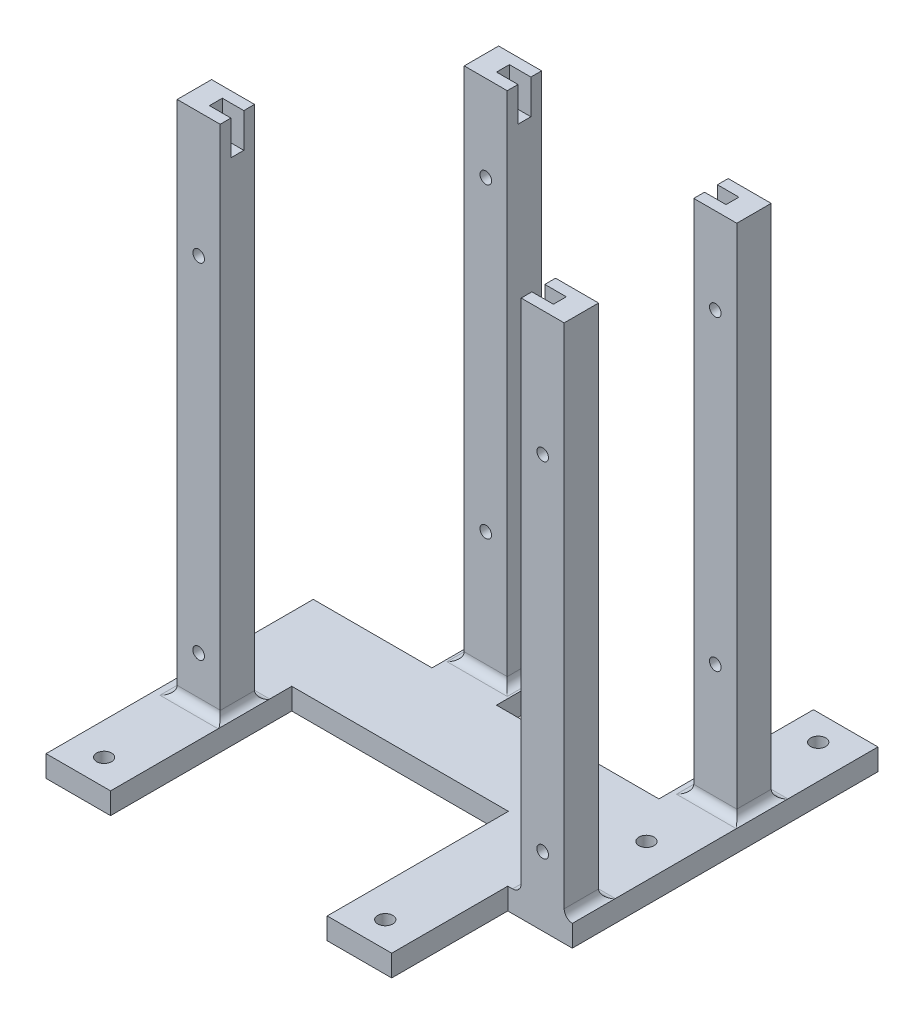
from build123d import *

# Parameters (mm, degrees)
SKETCH1_R           = 1.7499999999999998
SKETCH1_R_2         = 1.749999999999997
BOSS_EXTRUDE1_DEPTH = 5
SKETCH2_W           = 9.999999999999986
SKETCH2_H           = 7.9999999999999964
SKETCH2_H_2         = 8.000000000000028
BOSS_EXTRUDE2_DEPTH = 120
SKETCH3_R           = 2.500000000000001
SKETCH3_R_2         = 2.4999999999999996
SKETCH3_R_3         = 2.4999999999999956
BOSS_EXTRUDE3_DEPTH = 2
CUT_EXTRUDE1_REACH  = 170.68
SKETCH4_R           = 1.3500000000000016
SKETCH4_R_2         = 1.3500000000000005
SKETCH4_R_3         = 1.3500000000000054
SKETCH4_R_4         = 1.3500000000000065
SKETCH8_R           = 2.5000000000000027
SKETCH8_R_2         = 2.4999999999999956
BOSS_EXTRUDE5_DEPTH = 2
CUT_EXTRUDE3_REACH  = 177.137
SKETCH9_R           = 1.3499999999999999
SKETCH9_R_2         = 1.3499999999999979
SKETCH9_R_3         = 1.3500000000000065
FILLET1_R           = 2
SKETCH10_W          = 4.999999999999993
SKETCH10_H          = 2.9999999999999964
SKETCH10_W_2        = 5
SKETCH10_H_2        = 3.000000000000014
SKETCH10_W_3        = 4.999999999999986
CUT_EXTRUDE4_DEPTH  = 8


with BuildPart() as part:
    # Sketch1 → Boss-Extrude1 (new body)
    with BuildSketch(Plane(origin=(0, 0, 0), x_dir=(1, 0, 0), z_dir=(0, 1, 0))):
        Polygon((95.38000000000002, 26.999999999999996), (80.38000000000001, 27.000000000000004), (80.38000000000001, 3.47e-15), (65.38, 3.47e-15), (65.38, 42.13999999999999), (15, 42.13999999999999), (15, 8.1e-16), (0, 0), (0, 62.14), (27.60999999999998, 62.14), (27.609999999999985, 82.14), (42.60999999999998, 82.14), (42.609999999999985, 62.14), (80.38000000000001, 62.14), (80.38000000000002, 98.08), (95.38000000000001, 98.08), align=None)
        with Locations(Location((7.5, 6, 0), (0, 0, 270))):
            Circle(SKETCH1_R, mode=Mode.SUBTRACT)
        with Locations(Location((72.88, 5.999999999999998, 0), (0, 0, 270))):
            Circle(SKETCH1_R_2, mode=Mode.SUBTRACT)
        with Locations(Location((87.48999999999998, 52.14, 0), (0, 0, 270))):
            Circle(SKETCH1_R_2, mode=Mode.SUBTRACT)
        with Locations(Location((87.48999999999998, 92.08, 0), (0, 0, 270))):
            Circle(SKETCH1_R_2, mode=Mode.SUBTRACT)
    extrude(amount=BOSS_EXTRUDE1_DEPTH)

    # Sketch2 → Boss-Extrude2 (add)
    with BuildSketch(Plane(origin=(0, 5, 0), x_dir=(1, 0, 0), z_dir=(0, 1, 0))):
        with Locations((88.48999999999998, 31)):
            Rectangle(SKETCH2_W, SKETCH2_H)
        Polygon((13.489999999999974, 35), (3.489999999999993, 35), (3.4899999999999944, 26.99999999999999), (13.489999999999979, 26.999999999999993), align=None)
        Polygon((30.10999999999999, 75.14000000000001), (40.10999999999998, 75.14000000000001), (40.10999999999997, 67.14), (30.109999999999992, 67.14), align=None)
        with Locations((88.48999999999998, 71.14)):
            Rectangle(SKETCH2_W, SKETCH2_H_2)
    extrude(amount=BOSS_EXTRUDE2_DEPTH)

    # Sketch3 → Boss-Extrude3 (add)
    with BuildSketch(Plane(origin=(0, 0, -35), x_dir=(-1, 0, 0), z_dir=(0, 0, -1))):
        with Locations(Location((-8.489999999999984, 96, 0), (0, 0, 180))):
            Circle(SKETCH3_R)
        with Locations(Location((-8.489999999999984, 16, 0), (0, 0, 180))):
            Circle(SKETCH3_R_2)
        with Locations(Location((-88.48999999999998, 16, 0), (0, 0, 180))):
            Circle(SKETCH3_R_3)
        with Locations(Location((-88.48999999999998, 96, 0), (0, 0, 180))):
            Circle(SKETCH3_R_3)
    extrude(amount=BOSS_EXTRUDE3_DEPTH)

    # Sketch4 → Cut-Extrude1 (cut, up to next)
    with BuildSketch(Plane(origin=(0, 0, -37.00000000000001), x_dir=(-1, 0, 0), z_dir=(0, 0, -1)), mode=Mode.PRIVATE) as cut_extrude1_sk1:
        with Locations((-8.489999999999984, 96)):
            Circle(SKETCH4_R)
    cut_extrude1_tool1 = extrude(cut_extrude1_sk1.sketch, amount=-CUT_EXTRUDE1_REACH, mode=Mode.PRIVATE) & part.part
    # Sketch4 → Cut-Extrude1 (cut, up to next)
    with BuildSketch(Plane(origin=(0, 0, -37.00000000000001), x_dir=(-1, 0, 0), z_dir=(0, 0, -1)), mode=Mode.PRIVATE) as cut_extrude1_sk2:
        with Locations((-8.489999999999984, 16)):
            Circle(SKETCH4_R_2)
    cut_extrude1_tool2 = extrude(cut_extrude1_sk2.sketch, amount=-CUT_EXTRUDE1_REACH, mode=Mode.PRIVATE) & part.part
    # Sketch4 → Cut-Extrude1 (cut, up to next)
    with BuildSketch(Plane(origin=(0, 0, -37.00000000000001), x_dir=(-1, 0, 0), z_dir=(0, 0, -1)), mode=Mode.PRIVATE) as cut_extrude1_sk3:
        with Locations((-88.48999999999998, 16)):
            Circle(SKETCH4_R_3)
    cut_extrude1_tool3 = extrude(cut_extrude1_sk3.sketch, amount=-CUT_EXTRUDE1_REACH, mode=Mode.PRIVATE) & part.part
    # Sketch4 → Cut-Extrude1 (cut, up to next)
    with BuildSketch(Plane(origin=(0, 0, -37.00000000000001), x_dir=(-1, 0, 0), z_dir=(0, 0, -1)), mode=Mode.PRIVATE) as cut_extrude1_sk4:
        with Locations((-88.48999999999998, 96)):
            Circle(SKETCH4_R_4)
    cut_extrude1_tool4 = extrude(cut_extrude1_sk4.sketch, amount=-CUT_EXTRUDE1_REACH, mode=Mode.PRIVATE) & part.part
    add(cut_extrude1_tool1.solids().sort_by_distance((8.49, 96, -37))[0], mode=Mode.SUBTRACT)
    add(cut_extrude1_tool2.solids().sort_by_distance((8.49, 16, -37))[0], mode=Mode.SUBTRACT)
    add(cut_extrude1_tool3.solids().sort_by_distance((88.49, 16, -37))[0], mode=Mode.SUBTRACT)
    add(cut_extrude1_tool4.solids().sort_by_distance((88.49, 96, -37))[0], mode=Mode.SUBTRACT)

    # Sketch8 → Boss-Extrude5 (add)
    with BuildSketch(Plane(origin=(0, 0, -75.14000000000001), x_dir=(-1, 0, 0), z_dir=(0, 0, -1))):
        with Locations(Location((-35.10999999999998, 105, 0), (0, 0, 180))):
            Circle(SKETCH8_R)
        with Locations(Location((-35.10999999999997, 33.669999999999995, 0), (0, 0, 180))):
            Circle(SKETCH8_R)
        with Locations(Location((-88.48999999999998, 105, 0), (0, 0, 180))):
            Circle(SKETCH8_R_2)
        with Locations(Location((-88.48999999999998, 33.669999999999995, 0), (0, 0, 180))):
            Circle(SKETCH8_R_2)
    extrude(amount=BOSS_EXTRUDE5_DEPTH)

    # Sketch9 → Cut-Extrude3 (cut, up to next)
    with BuildSketch(Plane(origin=(0, 0, -77.14000000000001), x_dir=(-1, 0, 0), z_dir=(0, 0, -1)), mode=Mode.PRIVATE) as cut_extrude3_sk1:
        with Locations((-35.10999999999998, 105)):
            Circle(SKETCH9_R)
    cut_extrude3_tool1 = extrude(cut_extrude3_sk1.sketch, amount=-CUT_EXTRUDE3_REACH, mode=Mode.PRIVATE) & part.part
    # Sketch9 → Cut-Extrude3 (cut, up to next)
    with BuildSketch(Plane(origin=(0, 0, -77.14000000000001), x_dir=(-1, 0, 0), z_dir=(0, 0, -1)), mode=Mode.PRIVATE) as cut_extrude3_sk2:
        with Locations((-35.10999999999997, 33.669999999999995)):
            Circle(SKETCH9_R_2)
    cut_extrude3_tool2 = extrude(cut_extrude3_sk2.sketch, amount=-CUT_EXTRUDE3_REACH, mode=Mode.PRIVATE) & part.part
    # Sketch9 → Cut-Extrude3 (cut, up to next)
    with BuildSketch(Plane(origin=(0, 0, -77.14000000000001), x_dir=(-1, 0, 0), z_dir=(0, 0, -1)), mode=Mode.PRIVATE) as cut_extrude3_sk3:
        with Locations((-88.48999999999998, 33.669999999999995)):
            Circle(SKETCH9_R_3)
    cut_extrude3_tool3 = extrude(cut_extrude3_sk3.sketch, amount=-CUT_EXTRUDE3_REACH, mode=Mode.PRIVATE) & part.part
    # Sketch9 → Cut-Extrude3 (cut, up to next)
    with BuildSketch(Plane(origin=(0, 0, -77.14000000000001), x_dir=(-1, 0, 0), z_dir=(0, 0, -1)), mode=Mode.PRIVATE) as cut_extrude3_sk4:
        with Locations((-88.48999999999998, 105)):
            Circle(SKETCH9_R_3)
    cut_extrude3_tool4 = extrude(cut_extrude3_sk4.sketch, amount=-CUT_EXTRUDE3_REACH, mode=Mode.PRIVATE) & part.part
    add(cut_extrude3_tool1.solids().sort_by_distance((35.11, 105, -77.14))[0], mode=Mode.SUBTRACT)
    add(cut_extrude3_tool2.solids().sort_by_distance((35.11, 33.67, -77.14))[0], mode=Mode.SUBTRACT)
    add(cut_extrude3_tool3.solids().sort_by_distance((88.49, 33.67, -77.14))[0], mode=Mode.SUBTRACT)
    add(cut_extrude3_tool4.solids().sort_by_distance((88.49, 105, -77.14))[0], mode=Mode.SUBTRACT)

    # Fillet1
    # the kernel refuses this fillet: 2 mm, written as the material it adds along each edge
    with BuildSketch(Plane(origin=(93.48999999999998, 5, -27.000000000000004), x_dir=(1, 0, 0), z_dir=(0, 0, -1))) as fillet1_piece_1:
        with BuildLine():
            CenterArc((2, -1.9969727088771165), FILLET1_R, 93.1528588040452, 86.8471411959548)
            Line((0, -1.9969727088771165), (-0.04000000000000625, -1.9969727088771165))
            Line((-0.04000000000000625, -1.9969727088771165), (-0.04000000000000625, 0))
            Line((-0.04000000000000625, 0), (0, 0.04000000000000004))
            ThreePointArc((0, 0.04000000000000004), (0.9450000000000216, 0.04000000000000004), (1.8878000000000412, 0.03993945417754219))
            Line((1.8878000000000412, 0.03993945417754219), (1.8900000000000432, 0))
        make_face()
    extrude(amount=7.9999999999999964)
    with BuildSketch(Plane(origin=(93.48999999999998, 5, -75.14000000000001), x_dir=(1, 0, 0), z_dir=(0, 0, 1))) as fillet1_piece_2:
        with BuildLine():
            CenterArc((2, 1.9969727088771156), FILLET1_R, 180, 86.8471411959544)
            Line((0, 1.9969727088771156), (-0.04000000000000625, 1.9969727088771156))
            Line((-0.04000000000000625, 1.9969727088771156), (-0.04000000000000625, 0))
            Line((-0.04000000000000625, 0), (0, -0.04000000000000004))
            ThreePointArc((0, -0.04000000000000004), (0.9450000000000216, -0.04000000000000004), (1.887800000000027, -0.03993945417754219))
            Line((1.887800000000027, -0.03993945417754219), (1.890000000000029, 0))
        make_face()
    extrude(amount=8.000000000000028)
    with BuildSketch(Plane(origin=(93.48999999999998, 5, -67.13999999999999), x_dir=(0, 0, 1), z_dir=(-1, 0, 0)), Plane(origin=(83.49, 5, -75.14000000000001), x_dir=(0, 0, -1), z_dir=(1, 0, 0))) as fillet1_piece_3:
        with BuildLine():
            CenterArc((FILLET1_R, FILLET1_R), FILLET1_R, 180, 90)
            Line((0, FILLET1_R), (-FILLET1_R * 0.02, FILLET1_R))
            Line((-FILLET1_R * 0.02, FILLET1_R), (-FILLET1_R * 0.02, -FILLET1_R * 0.02))
            Line((-FILLET1_R * 0.02, -FILLET1_R * 0.02), (FILLET1_R, -FILLET1_R * 0.02))
            Line((FILLET1_R, -FILLET1_R * 0.02), (FILLET1_R, 0))
        make_face()
    extrude(amount=9.999999999999986)
    with BuildSketch(Plane(origin=(93.48999999999998, 5, -35), x_dir=(0, 0, -1), z_dir=(-1, 0, 0))) as fillet1_piece_4:
        with BuildLine():
            CenterArc((FILLET1_R, -FILLET1_R), FILLET1_R, 90, 90)
            Line((0, -FILLET1_R), (-FILLET1_R * 0.02, -FILLET1_R))
            Line((-FILLET1_R * 0.02, -FILLET1_R), (-FILLET1_R * 0.02, FILLET1_R * 0.02))
            Line((-FILLET1_R * 0.02, FILLET1_R * 0.02), (FILLET1_R, FILLET1_R * 0.02))
            Line((FILLET1_R, FILLET1_R * 0.02), (FILLET1_R, 0))
        make_face()
    extrude(amount=9.999999999999986)
    with BuildSketch(Plane(origin=(83.49, 5, -35), x_dir=(-1, 0, 0), z_dir=(0, 0, 1))) as fillet1_piece_5:
        with BuildLine():
            CenterArc((FILLET1_R, -FILLET1_R), FILLET1_R, 90, 90)
            Line((0, -FILLET1_R), (-FILLET1_R * 0.02, -FILLET1_R))
            Line((-FILLET1_R * 0.02, -FILLET1_R), (-FILLET1_R * 0.02, FILLET1_R * 0.02))
            Line((-FILLET1_R * 0.02, FILLET1_R * 0.02), (FILLET1_R, FILLET1_R * 0.02))
            Line((FILLET1_R, FILLET1_R * 0.02), (FILLET1_R, 0))
        make_face()
    extrude(amount=7.9999999999999964)
    with BuildSketch(Plane(origin=(83.49, 5, -67.13999999999999), x_dir=(-1, 0, 0), z_dir=(0, 0, -1))) as fillet1_piece_6:
        with BuildLine():
            CenterArc((FILLET1_R, FILLET1_R), FILLET1_R, 180, 90)
            Line((0, FILLET1_R), (-FILLET1_R * 0.02, FILLET1_R))
            Line((-FILLET1_R * 0.02, FILLET1_R), (-FILLET1_R * 0.02, -FILLET1_R * 0.02))
            Line((-FILLET1_R * 0.02, -FILLET1_R * 0.02), (FILLET1_R, -FILLET1_R * 0.02))
            Line((FILLET1_R, -FILLET1_R * 0.02), (FILLET1_R, 0))
        make_face()
    extrude(amount=8.000000000000028)
    with BuildSketch(Plane(origin=(30.10999999999999, 5, -75.14000000000001), x_dir=(0, 0, -1), z_dir=(1, 0, 0))) as fillet1_piece_7:
        with BuildLine():
            CenterArc((FILLET1_R, FILLET1_R), FILLET1_R, 180, 90)
            Line((0, FILLET1_R), (-FILLET1_R * 0.02, FILLET1_R))
            Line((-FILLET1_R * 0.02, FILLET1_R), (-FILLET1_R * 0.02, -FILLET1_R * 0.02))
            Line((-FILLET1_R * 0.02, -FILLET1_R * 0.02), (FILLET1_R, -FILLET1_R * 0.02))
            Line((FILLET1_R, -FILLET1_R * 0.02), (FILLET1_R, 0))
        make_face()
    extrude(amount=9.99999999999999)
    with BuildSketch(Plane(origin=(30.109999999999992, 5, -67.14), x_dir=(-1, 0, 4.4e-16), z_dir=(-4.4e-16, 0, -1))) as fillet1_piece_8:
        with BuildLine():
            CenterArc((FILLET1_R, FILLET1_R), FILLET1_R, 180, 90)
            Line((0, FILLET1_R), (-FILLET1_R * 0.02, FILLET1_R))
            Line((-FILLET1_R * 0.02, FILLET1_R), (-FILLET1_R * 0.02, -FILLET1_R * 0.02))
            Line((-FILLET1_R * 0.02, -FILLET1_R * 0.02), (FILLET1_R, -FILLET1_R * 0.02))
            Line((FILLET1_R, -FILLET1_R * 0.02), (FILLET1_R, 0))
        make_face()
    extrude(amount=8.000000000000014)
    with BuildSketch(Plane(origin=(40.10999999999998, 5, -75.14000000000001), x_dir=(1, 0, 8.9e-16), z_dir=(-8.9e-16, 0, 1))) as fillet1_piece_9:
        with BuildLine():
            CenterArc((FILLET1_R, FILLET1_R), FILLET1_R, 180, 90)
            Line((0, FILLET1_R), (-FILLET1_R * 0.02, FILLET1_R))
            Line((-FILLET1_R * 0.02, FILLET1_R), (-FILLET1_R * 0.02, -FILLET1_R * 0.02))
            Line((-FILLET1_R * 0.02, -FILLET1_R * 0.02), (FILLET1_R, -FILLET1_R * 0.02))
            Line((FILLET1_R, -FILLET1_R * 0.02), (FILLET1_R, 0))
        make_face()
    extrude(amount=8.000000000000014)
    with BuildSketch(Plane(origin=(40.10999999999997, 5, -67.14), x_dir=(0, 0, 1), z_dir=(-1, 0, 0))) as fillet1_piece_10:
        with BuildLine():
            CenterArc((FILLET1_R, FILLET1_R), FILLET1_R, 180, 90)
            Line((0, FILLET1_R), (-FILLET1_R * 0.02, FILLET1_R))
            Line((-FILLET1_R * 0.02, FILLET1_R), (-FILLET1_R * 0.02, -FILLET1_R * 0.02))
            Line((-FILLET1_R * 0.02, -FILLET1_R * 0.02), (FILLET1_R, -FILLET1_R * 0.02))
            Line((FILLET1_R, -FILLET1_R * 0.02), (FILLET1_R, 0))
        make_face()
    extrude(amount=9.999999999999979)
    with BuildSketch(Plane(origin=(13.489999999999979, 5, -26.999999999999993), x_dir=(1, 0, -6.7e-16), z_dir=(-6.7e-16, 0, -1))) as fillet1_piece_11:
        with BuildLine():
            CenterArc((2, -1.939046157263932), FILLET1_R, 104.18183372856282, 75.81816627143718)
            Line((0, -1.939046157263932), (-0.03999999999999915, -1.939046157263932))
            Line((-0.03999999999999915, -1.939046157263932), (-0.03999999999999915, 0))
            Line((-0.03999999999999915, 0), (0, 0.04000000000000004))
            ThreePointArc((0, 0.04000000000000004), (0.7550000000000114, 0.04000000000000004), (1.5002000000000209, 0.03878092314527848))
            Line((1.5002000000000209, 0.03878092314527848), (1.510000000000021, 0))
        make_face()
    extrude(amount=8.000000000000007)
    with BuildSketch(Plane(origin=(3.4899999999999944, 5, -26.99999999999999), x_dir=(3.6e-16, 0, 1), z_dir=(1, 0, -3.6e-16))) as fillet1_piece_12:
        with BuildLine():
            CenterArc((FILLET1_R, -FILLET1_R), FILLET1_R, 90, 90)
            Line((0, -FILLET1_R), (-FILLET1_R * 0.02, -FILLET1_R))
            Line((-FILLET1_R * 0.02, -FILLET1_R), (-FILLET1_R * 0.02, FILLET1_R * 0.02))
            Line((-FILLET1_R * 0.02, FILLET1_R * 0.02), (FILLET1_R, FILLET1_R * 0.02))
            Line((FILLET1_R, FILLET1_R * 0.02), (FILLET1_R, 0))
        make_face()
    extrude(amount=9.999999999999984)
    with BuildSketch(Plane(origin=(13.489999999999974, 5, -35), x_dir=(0, 0, -1), z_dir=(-1, 0, 0))) as fillet1_piece_13:
        with BuildLine():
            CenterArc((FILLET1_R, -FILLET1_R), FILLET1_R, 90, 90)
            Line((0, -FILLET1_R), (-FILLET1_R * 0.02, -FILLET1_R))
            Line((-FILLET1_R * 0.02, -FILLET1_R), (-FILLET1_R * 0.02, FILLET1_R * 0.02))
            Line((-FILLET1_R * 0.02, FILLET1_R * 0.02), (FILLET1_R, FILLET1_R * 0.02))
            Line((FILLET1_R, FILLET1_R * 0.02), (FILLET1_R, 0))
        make_face()
    extrude(amount=9.99999999999998)
    with BuildSketch(Plane(origin=(3.489999999999993, 5, -35), x_dir=(-1, 0, 1.7e-16), z_dir=(1.7e-16, 0, 1))) as fillet1_piece_14:
        with BuildLine():
            CenterArc((FILLET1_R, -FILLET1_R), FILLET1_R, 90, 90)
            Line((-1.78e-15, -FILLET1_R), (-FILLET1_R * 0.02, -FILLET1_R))
            Line((-FILLET1_R * 0.02, -FILLET1_R), (-FILLET1_R * 0.02, FILLET1_R * 0.02))
            Line((-FILLET1_R * 0.02, FILLET1_R * 0.02), (FILLET1_R, FILLET1_R * 0.02))
            Line((FILLET1_R, FILLET1_R * 0.02), (FILLET1_R, 0))
        make_face()
    extrude(amount=8.00000000000001)
    with BuildSketch(Plane(origin=(98.48999999999998, 5, -35), x_dir=(0, 0, -1), z_dir=(-1, 0, 0))) as fillet1_piece_15a_section:
        with BuildLine():
            CenterArc((FILLET1_R, -FILLET1_R), FILLET1_R, 90, 90)
            Line((0, -FILLET1_R), (-FILLET1_R * 0.02, -FILLET1_R))
            Line((-FILLET1_R * 0.02, -FILLET1_R), (-FILLET1_R * 0.02, FILLET1_R * 0.02))
            Line((-FILLET1_R * 0.02, FILLET1_R * 0.02), (FILLET1_R, FILLET1_R * 0.02))
            Line((FILLET1_R, FILLET1_R * 0.02), (FILLET1_R, 0))
        make_face()
    fillet1_piece_15a = extrude(amount=14.999999999999986, mode=Mode.PRIVATE)
    fillet1_piece_15a = split(fillet1_piece_15a, bisect_by=Plane(origin=(95.38000000000002, 5.45279022853365, -35.45279022853365), z_dir=(-1, 0, 2e-16)), keep=Keep.TOP, mode=Mode.PRIVATE)
    fillet1_piece_15a = split(fillet1_piece_15a, bisect_by=Plane(origin=(93.48999999999998, 5.45279022853365, -35.45279022853366), z_dir=(1, 0, 0)), keep=Keep.TOP, mode=Mode.PRIVATE)
    with BuildSketch(Plane(origin=(93.48999999999998, 5, -27.000000000000004), x_dir=(1, 0, 0), z_dir=(0, 0, -1))) as fillet1_piece_15b_section:
        with BuildLine():
            CenterArc((2, -1.9969727088771165), FILLET1_R, 93.1528588040452, 86.8471411959548)
            Line((0, -1.9969727088771165), (-0.04000000000000625, -1.9969727088771165))
            Line((-0.04000000000000625, -1.9969727088771165), (-0.04000000000000625, 0))
            Line((-0.04000000000000625, 0), (0, 0.04000000000000004))
            ThreePointArc((0, 0.04000000000000004), (0.9450000000000216, 0.04000000000000004), (1.8878000000000412, 0.03993945417754219))
            Line((1.8878000000000412, 0.03993945417754219), (1.8900000000000432, 0))
        make_face()
    fillet1_piece_15b = extrude(amount=12.992431772192784, mode=Mode.PRIVATE)
    fillet1_piece_15b = split(fillet1_piece_15b, bisect_by=Plane(origin=(93.93367607415175, 5.45512800985492, -35), z_dir=(0, 0, -1)), keep=Keep.TOP, mode=Mode.PRIVATE)
    fillet1_piece_15 = fillet1_piece_15a & fillet1_piece_15b
    add(fillet1_piece_15)
    with BuildSketch(Plane(origin=(83.49, 5, -75.14000000000001), x_dir=(0, 0, -1), z_dir=(1, 0, 0))) as fillet1_piece_16a_section:
        with BuildLine():
            CenterArc((FILLET1_R, FILLET1_R), FILLET1_R, 180, 90)
            Line((0, FILLET1_R), (-FILLET1_R * 0.02, FILLET1_R))
            Line((-FILLET1_R * 0.02, FILLET1_R), (-FILLET1_R * 0.02, -FILLET1_R * 0.02))
            Line((-FILLET1_R * 0.02, -FILLET1_R * 0.02), (FILLET1_R, -FILLET1_R * 0.02))
            Line((FILLET1_R, -FILLET1_R * 0.02), (FILLET1_R, 0))
        make_face()
    fillet1_piece_16a = extrude(amount=14.999999999999986, mode=Mode.PRIVATE)
    fillet1_piece_16a = split(fillet1_piece_16a, bisect_by=Plane(origin=(95.38000000000001, 5.452790228533658, -75.59279022853367), z_dir=(-1, 0, 2e-16)), keep=Keep.TOP, mode=Mode.PRIVATE)
    fillet1_piece_16a = split(fillet1_piece_16a, bisect_by=Plane(origin=(93.48999999999998, 5.452790228533658, -75.59279022853367), z_dir=(1, 0, 0)), keep=Keep.TOP, mode=Mode.PRIVATE)
    with BuildSketch(Plane(origin=(93.48999999999998, 5, -80.1324317721928), x_dir=(1, 0, 0), z_dir=(0, 0, 1))) as fillet1_piece_16b_section:
        with BuildLine():
            CenterArc((2, 1.9969727088771156), FILLET1_R, 180, 86.8471411959544)
            Line((0, 1.9969727088771156), (-0.04000000000000625, 1.9969727088771156))
            Line((-0.04000000000000625, 1.9969727088771156), (-0.04000000000000625, 0))
            Line((-0.04000000000000625, 0), (0, -0.04000000000000004))
            ThreePointArc((0, -0.04000000000000004), (0.9450000000000216, -0.04000000000000004), (1.887800000000027, -0.03993945417754219))
            Line((1.887800000000027, -0.03993945417754219), (1.890000000000029, 0))
        make_face()
    fillet1_piece_16b = extrude(amount=12.992431772192816, mode=Mode.PRIVATE)
    fillet1_piece_16b = split(fillet1_piece_16b, bisect_by=Plane(origin=(93.93367607415274, 5.455128009853669, -75.14000000000001), z_dir=(0, 0, -1)), keep=Keep.TOP, mode=Mode.PRIVATE)
    fillet1_piece_16 = fillet1_piece_16a & fillet1_piece_16b
    add(fillet1_piece_16)
    with BuildSketch(Plane(origin=(93.48999999999998, 5, -75.14000000000001), x_dir=(1, 0, 0), z_dir=(0, 0, 1))) as fillet1_piece_17a_section:
        with BuildLine():
            CenterArc((2, 1.9969727088771156), FILLET1_R, 180, 86.8471411959544)
            Line((0, 1.9969727088771156), (-0.04000000000000625, 1.9969727088771156))
            Line((-0.04000000000000625, 1.9969727088771156), (-0.04000000000000625, 0))
            Line((-0.04000000000000625, 0), (0, -0.04000000000000004))
            ThreePointArc((0, -0.04000000000000004), (0.9450000000000216, -0.04000000000000004), (1.887800000000027, -0.03993945417754219))
            Line((1.887800000000027, -0.03993945417754219), (1.890000000000029, 0))
        make_face()
    fillet1_piece_17a = extrude(amount=12.992431772192816, mode=Mode.PRIVATE)
    fillet1_piece_17a = split(fillet1_piece_17a, bisect_by=Plane(origin=(93.93367607415267, 5.45512800985373, -67.13999999999999), z_dir=(0, 0, 1)), keep=Keep.TOP, mode=Mode.PRIVATE)
    with BuildSketch(Plane(origin=(98.48999999999998, 5, -67.13999999999999), x_dir=(0, 0, 1), z_dir=(-1, 0, 0))) as fillet1_piece_17b_section:
        with BuildLine():
            CenterArc((FILLET1_R, FILLET1_R), FILLET1_R, 180, 90)
            Line((0, FILLET1_R), (-FILLET1_R * 0.02, FILLET1_R))
            Line((-FILLET1_R * 0.02, FILLET1_R), (-FILLET1_R * 0.02, -FILLET1_R * 0.02))
            Line((-FILLET1_R * 0.02, -FILLET1_R * 0.02), (FILLET1_R, -FILLET1_R * 0.02))
            Line((FILLET1_R, -FILLET1_R * 0.02), (FILLET1_R, 0))
        make_face()
    fillet1_piece_17b = extrude(amount=14.999999999999986, mode=Mode.PRIVATE)
    fillet1_piece_17b = split(fillet1_piece_17b, bisect_by=Plane(origin=(95.38000000000001, 5.452790228533658, -66.68720977146636), z_dir=(-1, 0, 2e-16)), keep=Keep.TOP, mode=Mode.PRIVATE)
    fillet1_piece_17b = split(fillet1_piece_17b, bisect_by=Plane(origin=(93.48999999999998, 5.452790228533658, -66.68720977146636), z_dir=(1, 0, 0)), keep=Keep.TOP, mode=Mode.PRIVATE)
    fillet1_piece_17 = fillet1_piece_17a & fillet1_piece_17b
    add(fillet1_piece_17)
    with BuildSketch(Plane(origin=(93.48999999999998, 5, -67.13999999999999), x_dir=(0, 0, 1), z_dir=(-1, 0, 0))) as fillet1_piece_18a_section:
        with BuildLine():
            CenterArc((FILLET1_R, FILLET1_R), FILLET1_R, 180, 90)
            Line((0, FILLET1_R), (-FILLET1_R * 0.02, FILLET1_R))
            Line((-FILLET1_R * 0.02, FILLET1_R), (-FILLET1_R * 0.02, -FILLET1_R * 0.02))
            Line((-FILLET1_R * 0.02, -FILLET1_R * 0.02), (FILLET1_R, -FILLET1_R * 0.02))
            Line((FILLET1_R, -FILLET1_R * 0.02), (FILLET1_R, 0))
        make_face()
    fillet1_piece_18a = extrude(amount=14.999999999999986, mode=Mode.PRIVATE)
    fillet1_piece_18a = split(fillet1_piece_18a, bisect_by=Plane(origin=(80.38000000000001, 5.452790228533659, -66.68720977146634), z_dir=(1, 0, 4e-16)), keep=Keep.TOP, mode=Mode.PRIVATE)
    fillet1_piece_18a = split(fillet1_piece_18a, bisect_by=Plane(origin=(83.49, 5.452790228533659, -66.68720977146634), z_dir=(-1, 0, 0)), keep=Keep.TOP, mode=Mode.PRIVATE)
    with BuildSketch(Plane(origin=(83.49, 5, -62.139999999999986), x_dir=(-1, 0, 0), z_dir=(0, 0, -1))) as fillet1_piece_18b_section:
        with BuildLine():
            CenterArc((FILLET1_R, FILLET1_R), FILLET1_R, 180, 90)
            Line((0, FILLET1_R), (-FILLET1_R * 0.02, FILLET1_R))
            Line((-FILLET1_R * 0.02, FILLET1_R), (-FILLET1_R * 0.02, -FILLET1_R * 0.02))
            Line((-FILLET1_R * 0.02, -FILLET1_R * 0.02), (FILLET1_R, -FILLET1_R * 0.02))
            Line((FILLET1_R, -FILLET1_R * 0.02), (FILLET1_R, 0))
        make_face()
    fillet1_piece_18b = extrude(amount=13.000000000000028, mode=Mode.PRIVATE)
    fillet1_piece_18b = split(fillet1_piece_18b, bisect_by=Plane(origin=(83.03720977146635, 5.452790228533657, -67.13999999999999), z_dir=(0, 0, 1)), keep=Keep.TOP, mode=Mode.PRIVATE)
    fillet1_piece_18 = fillet1_piece_18a & fillet1_piece_18b
    add(fillet1_piece_18)
    with BuildSketch(Plane(origin=(83.49, 5, -40), x_dir=(-1, 0, 0), z_dir=(0, 0, 1))) as fillet1_piece_19a_section:
        with BuildLine():
            CenterArc((FILLET1_R, -FILLET1_R), FILLET1_R, 90, 90)
            Line((0, -FILLET1_R), (-FILLET1_R * 0.02, -FILLET1_R))
            Line((-FILLET1_R * 0.02, -FILLET1_R), (-FILLET1_R * 0.02, FILLET1_R * 0.02))
            Line((-FILLET1_R * 0.02, FILLET1_R * 0.02), (FILLET1_R, FILLET1_R * 0.02))
            Line((FILLET1_R, FILLET1_R * 0.02), (FILLET1_R, 0))
        make_face()
    fillet1_piece_19a = extrude(amount=12.999999999999996, mode=Mode.PRIVATE)
    fillet1_piece_19a = split(fillet1_piece_19a, bisect_by=Plane(origin=(83.03720977146637, 5.452790228533658, -35), z_dir=(0, 0, -1)), keep=Keep.TOP, mode=Mode.PRIVATE)
    with BuildSketch(Plane(origin=(93.48999999999998, 5, -35), x_dir=(0, 0, -1), z_dir=(-1, 0, 0))) as fillet1_piece_19b_section:
        with BuildLine():
            CenterArc((FILLET1_R, -FILLET1_R), FILLET1_R, 90, 90)
            Line((0, -FILLET1_R), (-FILLET1_R * 0.02, -FILLET1_R))
            Line((-FILLET1_R * 0.02, -FILLET1_R), (-FILLET1_R * 0.02, FILLET1_R * 0.02))
            Line((-FILLET1_R * 0.02, FILLET1_R * 0.02), (FILLET1_R, FILLET1_R * 0.02))
            Line((FILLET1_R, FILLET1_R * 0.02), (FILLET1_R, 0))
        make_face()
    fillet1_piece_19b = extrude(amount=14.999999999999986, mode=Mode.PRIVATE)
    fillet1_piece_19b = split(fillet1_piece_19b, bisect_by=Plane(origin=(83.49, 5.45279022853365, -35.45279022853366), z_dir=(-1, 0, 0)), keep=Keep.TOP, mode=Mode.PRIVATE)
    fillet1_piece_19 = fillet1_piece_19a & fillet1_piece_19b
    add(fillet1_piece_19)
    with BuildSketch(Plane(origin=(78.49, 5, -75.14000000000001), x_dir=(0, 0, -1), z_dir=(1, 0, 0))) as fillet1_piece_20a_section:
        with BuildLine():
            CenterArc((FILLET1_R, FILLET1_R), FILLET1_R, 180, 90)
            Line((0, FILLET1_R), (-FILLET1_R * 0.02, FILLET1_R))
            Line((-FILLET1_R * 0.02, FILLET1_R), (-FILLET1_R * 0.02, -FILLET1_R * 0.02))
            Line((-FILLET1_R * 0.02, -FILLET1_R * 0.02), (FILLET1_R, -FILLET1_R * 0.02))
            Line((FILLET1_R, -FILLET1_R * 0.02), (FILLET1_R, 0))
        make_face()
    fillet1_piece_20a = extrude(amount=14.999999999999986, mode=Mode.PRIVATE)
    fillet1_piece_20a = split(fillet1_piece_20a, bisect_by=Plane(origin=(80.38000000000001, 5.452790228533659, -75.59279022853367), z_dir=(1, 0, 4e-16)), keep=Keep.TOP, mode=Mode.PRIVATE)
    fillet1_piece_20a = split(fillet1_piece_20a, bisect_by=Plane(origin=(83.49, 5.452790228533659, -75.59279022853367), z_dir=(-1, 0, 0)), keep=Keep.TOP, mode=Mode.PRIVATE)
    with BuildSketch(Plane(origin=(83.49, 5, -67.13999999999999), x_dir=(-1, 0, 0), z_dir=(0, 0, -1))) as fillet1_piece_20b_section:
        with BuildLine():
            CenterArc((FILLET1_R, FILLET1_R), FILLET1_R, 180, 90)
            Line((0, FILLET1_R), (-FILLET1_R * 0.02, FILLET1_R))
            Line((-FILLET1_R * 0.02, FILLET1_R), (-FILLET1_R * 0.02, -FILLET1_R * 0.02))
            Line((-FILLET1_R * 0.02, -FILLET1_R * 0.02), (FILLET1_R, -FILLET1_R * 0.02))
            Line((FILLET1_R, -FILLET1_R * 0.02), (FILLET1_R, 0))
        make_face()
    fillet1_piece_20b = extrude(amount=13.000000000000028, mode=Mode.PRIVATE)
    fillet1_piece_20b = split(fillet1_piece_20b, bisect_by=Plane(origin=(83.03720977146634, 5.452790228533658, -75.14000000000001), z_dir=(0, 0, -1)), keep=Keep.TOP, mode=Mode.PRIVATE)
    fillet1_piece_20 = fillet1_piece_20a & fillet1_piece_20b
    add(fillet1_piece_20)
    with BuildSketch(Plane(origin=(25.10999999999999, 5, -75.14000000000001), x_dir=(0, 0, -1), z_dir=(1, 0, 0))) as fillet1_piece_21a_section:
        with BuildLine():
            CenterArc((FILLET1_R, FILLET1_R), FILLET1_R, 180, 90)
            Line((0, FILLET1_R), (-FILLET1_R * 0.02, FILLET1_R))
            Line((-FILLET1_R * 0.02, FILLET1_R), (-FILLET1_R * 0.02, -FILLET1_R * 0.02))
            Line((-FILLET1_R * 0.02, -FILLET1_R * 0.02), (FILLET1_R, -FILLET1_R * 0.02))
            Line((FILLET1_R, -FILLET1_R * 0.02), (FILLET1_R, 0))
        make_face()
    fillet1_piece_21a = extrude(amount=14.99999999999999, mode=Mode.PRIVATE)
    fillet1_piece_21a = split(fillet1_piece_21a, bisect_by=Plane(origin=(27.609999999999985, 5.452790228533658, -75.59279022853363), z_dir=(1, 0, 1.8e-16)), keep=Keep.TOP, mode=Mode.PRIVATE)
    fillet1_piece_21a = split(fillet1_piece_21a, bisect_by=Plane(origin=(30.10999999999999, 5.452790228533658, -75.59279022853364), z_dir=(-1, 0, 4.4e-16)), keep=Keep.TOP, mode=Mode.PRIVATE)
    with BuildSketch(Plane(origin=(30.109999999999992, 5, -67.14), x_dir=(-1, 0, 4.4e-16), z_dir=(-4.4e-16, 0, -1))) as fillet1_piece_21b_section:
        with BuildLine():
            CenterArc((FILLET1_R, FILLET1_R), FILLET1_R, 180, 90)
            Line((0, FILLET1_R), (-FILLET1_R * 0.02, FILLET1_R))
            Line((-FILLET1_R * 0.02, FILLET1_R), (-FILLET1_R * 0.02, -FILLET1_R * 0.02))
            Line((-FILLET1_R * 0.02, -FILLET1_R * 0.02), (FILLET1_R, -FILLET1_R * 0.02))
            Line((FILLET1_R, -FILLET1_R * 0.02), (FILLET1_R, 0))
        make_face()
    fillet1_piece_21b = extrude(amount=13.000000000000014, mode=Mode.PRIVATE)
    fillet1_piece_21b = split(fillet1_piece_21b, bisect_by=Plane(origin=(29.657209771466338, 5.452790228533651, -75.14000000000001), z_dir=(0, 0, -1)), keep=Keep.TOP, mode=Mode.PRIVATE)
    fillet1_piece_21 = fillet1_piece_21a & fillet1_piece_21b
    add(fillet1_piece_21)
    with BuildSketch(Plane(origin=(30.10999999999999, 5, -75.14000000000001), x_dir=(0, 0, -1), z_dir=(1, 0, 0))) as fillet1_piece_22a_section:
        with BuildLine():
            CenterArc((FILLET1_R, FILLET1_R), FILLET1_R, 180, 90)
            Line((0, FILLET1_R), (-FILLET1_R * 0.02, FILLET1_R))
            Line((-FILLET1_R * 0.02, FILLET1_R), (-FILLET1_R * 0.02, -FILLET1_R * 0.02))
            Line((-FILLET1_R * 0.02, -FILLET1_R * 0.02), (FILLET1_R, -FILLET1_R * 0.02))
            Line((FILLET1_R, -FILLET1_R * 0.02), (FILLET1_R, 0))
        make_face()
    fillet1_piece_22a = extrude(amount=14.99999999999999, mode=Mode.PRIVATE)
    fillet1_piece_22a = split(fillet1_piece_22a, bisect_by=Plane(origin=(42.60999999999998, 5.452790228533659, -75.59279022853367), z_dir=(-1, 0, 3.6e-16)), keep=Keep.TOP, mode=Mode.PRIVATE)
    fillet1_piece_22a = split(fillet1_piece_22a, bisect_by=Plane(origin=(40.10999999999998, 5.452790228533659, -75.59279022853367), z_dir=(1, 0, 8.9e-16)), keep=Keep.TOP, mode=Mode.PRIVATE)
    with BuildSketch(Plane(origin=(40.109999999999985, 5, -80.14000000000001), x_dir=(1, 0, 8.9e-16), z_dir=(-8.9e-16, 0, 1))) as fillet1_piece_22b_section:
        with BuildLine():
            CenterArc((FILLET1_R, FILLET1_R), FILLET1_R, 180, 90)
            Line((0, FILLET1_R), (-FILLET1_R * 0.02, FILLET1_R))
            Line((-FILLET1_R * 0.02, FILLET1_R), (-FILLET1_R * 0.02, -FILLET1_R * 0.02))
            Line((-FILLET1_R * 0.02, -FILLET1_R * 0.02), (FILLET1_R, -FILLET1_R * 0.02))
            Line((FILLET1_R, -FILLET1_R * 0.02), (FILLET1_R, 0))
        make_face()
    fillet1_piece_22b = extrude(amount=13.000000000000014, mode=Mode.PRIVATE)
    fillet1_piece_22b = split(fillet1_piece_22b, bisect_by=Plane(origin=(40.56279022853363, 5.452790228533649, -75.14000000000001), z_dir=(0, 0, -1)), keep=Keep.TOP, mode=Mode.PRIVATE)
    fillet1_piece_22 = fillet1_piece_22a & fillet1_piece_22b
    add(fillet1_piece_22)
    with BuildSketch(Plane(origin=(40.10999999999997, 5, -67.14), x_dir=(0, 0, 1), z_dir=(-1, 0, 0))) as fillet1_piece_23a_section:
        with BuildLine():
            CenterArc((FILLET1_R, FILLET1_R), FILLET1_R, 180, 90)
            Line((0, FILLET1_R), (-FILLET1_R * 0.02, FILLET1_R))
            Line((-FILLET1_R * 0.02, FILLET1_R), (-FILLET1_R * 0.02, -FILLET1_R * 0.02))
            Line((-FILLET1_R * 0.02, -FILLET1_R * 0.02), (FILLET1_R, -FILLET1_R * 0.02))
            Line((FILLET1_R, -FILLET1_R * 0.02), (FILLET1_R, 0))
        make_face()
    fillet1_piece_23a = extrude(amount=14.999999999999979, mode=Mode.PRIVATE)
    fillet1_piece_23a = split(fillet1_piece_23a, bisect_by=Plane(origin=(27.60999999999998, 5.45279022853366, -66.68720977146634), z_dir=(1, 0, 1.8e-16)), keep=Keep.TOP, mode=Mode.PRIVATE)
    fillet1_piece_23a = split(fillet1_piece_23a, bisect_by=Plane(origin=(30.109999999999992, 5.45279022853366, -66.68720977146636), z_dir=(-1, 0, 4.4e-16)), keep=Keep.TOP, mode=Mode.PRIVATE)
    with BuildSketch(Plane(origin=(30.109999999999996, 5, -62.14), x_dir=(-1, 0, 4.4e-16), z_dir=(-4.4e-16, 0, -1))) as fillet1_piece_23b_section:
        with BuildLine():
            CenterArc((FILLET1_R, FILLET1_R), FILLET1_R, 180, 90)
            Line((0, FILLET1_R), (-FILLET1_R * 0.02, FILLET1_R))
            Line((-FILLET1_R * 0.02, FILLET1_R), (-FILLET1_R * 0.02, -FILLET1_R * 0.02))
            Line((-FILLET1_R * 0.02, -FILLET1_R * 0.02), (FILLET1_R, -FILLET1_R * 0.02))
            Line((FILLET1_R, -FILLET1_R * 0.02), (FILLET1_R, 0))
        make_face()
    fillet1_piece_23b = extrude(amount=13.000000000000014, mode=Mode.PRIVATE)
    fillet1_piece_23b = split(fillet1_piece_23b, bisect_by=Plane(origin=(29.657209771466345, 5.452790228533649, -67.14), z_dir=(0, 0, 1)), keep=Keep.TOP, mode=Mode.PRIVATE)
    fillet1_piece_23 = fillet1_piece_23a & fillet1_piece_23b
    add(fillet1_piece_23)
    with BuildSketch(Plane(origin=(40.10999999999998, 5, -75.14000000000001), x_dir=(1, 0, 8.9e-16), z_dir=(-8.9e-16, 0, 1))) as fillet1_piece_24a_section:
        with BuildLine():
            CenterArc((FILLET1_R, FILLET1_R), FILLET1_R, 180, 90)
            Line((0, FILLET1_R), (-FILLET1_R * 0.02, FILLET1_R))
            Line((-FILLET1_R * 0.02, FILLET1_R), (-FILLET1_R * 0.02, -FILLET1_R * 0.02))
            Line((-FILLET1_R * 0.02, -FILLET1_R * 0.02), (FILLET1_R, -FILLET1_R * 0.02))
            Line((FILLET1_R, -FILLET1_R * 0.02), (FILLET1_R, 0))
        make_face()
    fillet1_piece_24a = extrude(amount=13.000000000000014, mode=Mode.PRIVATE)
    fillet1_piece_24a = split(fillet1_piece_24a, bisect_by=Plane(origin=(40.56279022853362, 5.45279022853365, -67.14), z_dir=(0, 0, 1)), keep=Keep.TOP, mode=Mode.PRIVATE)
    with BuildSketch(Plane(origin=(45.10999999999997, 5, -67.14), x_dir=(0, 0, 1), z_dir=(-1, 0, 0))) as fillet1_piece_24b_section:
        with BuildLine():
            CenterArc((FILLET1_R, FILLET1_R), FILLET1_R, 180, 90)
            Line((0, FILLET1_R), (-FILLET1_R * 0.02, FILLET1_R))
            Line((-FILLET1_R * 0.02, FILLET1_R), (-FILLET1_R * 0.02, -FILLET1_R * 0.02))
            Line((-FILLET1_R * 0.02, -FILLET1_R * 0.02), (FILLET1_R, -FILLET1_R * 0.02))
            Line((FILLET1_R, -FILLET1_R * 0.02), (FILLET1_R, 0))
        make_face()
    fillet1_piece_24b = extrude(amount=14.999999999999979, mode=Mode.PRIVATE)
    fillet1_piece_24b = split(fillet1_piece_24b, bisect_by=Plane(origin=(42.609999999999985, 5.452790228533659, -66.68720977146634), z_dir=(-1, 0, 3.6e-16)), keep=Keep.TOP, mode=Mode.PRIVATE)
    fillet1_piece_24b = split(fillet1_piece_24b, bisect_by=Plane(origin=(40.10999999999997, 5.452790228533659, -66.68720977146634), z_dir=(1, 0, 8.9e-16)), keep=Keep.TOP, mode=Mode.PRIVATE)
    fillet1_piece_24 = fillet1_piece_24a & fillet1_piece_24b
    add(fillet1_piece_24)
    with BuildSketch(Plane(origin=(13.48999999999998, 5, -22.15238460684016), x_dir=(1, 0, -6.7e-16), z_dir=(-6.7e-16, 0, -1))) as fillet1_piece_25a_section:
        with BuildLine():
            CenterArc((2.0000000000000018, -1.939046157263931), FILLET1_R, 104.18183372856294, 75.81816627143706)
            Line((1.78e-15, -1.939046157263931), (-0.03999999999999737, -1.939046157263931))
            Line((-0.03999999999999737, -1.939046157263931), (-0.03999999999999915, 0))
            Line((-0.03999999999999915, 0), (0, 0.04000000000000004))
            ThreePointArc((0, 0.04000000000000004), (0.7550000000000097, 0.04000000000000004), (1.500200000000019, 0.03878092314527848))
            Line((1.500200000000019, 0.03878092314527848), (1.5100000000000193, 0))
        make_face()
    fillet1_piece_25a = extrude(amount=12.847615393159838, mode=Mode.PRIVATE)
    fillet1_piece_25a = split(fillet1_piece_25a, bisect_by=Plane(origin=(13.871258075365855, 5.4564300549704745, -26.999999999999993), z_dir=(3.6e-16, 0, 1)), keep=Keep.TOP, mode=Mode.PRIVATE)
    with BuildSketch(Plane(origin=(3.4899999999999944, 5, -26.99999999999999), x_dir=(3.6e-16, 0, 1), z_dir=(1, 0, -3.6e-16))) as fillet1_piece_25b_section:
        with BuildLine():
            CenterArc((FILLET1_R, -FILLET1_R), FILLET1_R, 90, 90)
            Line((0, -FILLET1_R), (-FILLET1_R * 0.02, -FILLET1_R))
            Line((-FILLET1_R * 0.02, -FILLET1_R), (-FILLET1_R * 0.02, FILLET1_R * 0.02))
            Line((-FILLET1_R * 0.02, FILLET1_R * 0.02), (FILLET1_R, FILLET1_R * 0.02))
            Line((FILLET1_R, FILLET1_R * 0.02), (FILLET1_R, 0))
        make_face()
    fillet1_piece_25b = extrude(amount=14.999999999999982, mode=Mode.PRIVATE)
    fillet1_piece_25b = split(fillet1_piece_25b, bisect_by=Plane(origin=(15, 5.452790228533649, -26.547209771466342), z_dir=(-1, 0, 0)), keep=Keep.TOP, mode=Mode.PRIVATE)
    fillet1_piece_25b = split(fillet1_piece_25b, bisect_by=Plane(origin=(13.489999999999979, 5.452790228533649, -26.547209771466342), z_dir=(1, 0, -6.7e-16)), keep=Keep.TOP, mode=Mode.PRIVATE)
    fillet1_piece_25 = fillet1_piece_25a & fillet1_piece_25b
    add(fillet1_piece_25)
    with BuildSketch(Plane(origin=(13.489999999999979, 5, -26.999999999999993), x_dir=(1, 0, -6.7e-16), z_dir=(-6.7e-16, 0, -1))) as fillet1_piece_26a_section:
        with BuildLine():
            CenterArc((2, -1.939046157263932), FILLET1_R, 104.18183372856282, 75.81816627143718)
            Line((0, -1.939046157263932), (-0.03999999999999915, -1.939046157263932))
            Line((-0.03999999999999915, -1.939046157263932), (-0.03999999999999915, 0))
            Line((-0.03999999999999915, 0), (0, 0.04000000000000004))
            ThreePointArc((0, 0.04000000000000004), (0.7550000000000114, 0.04000000000000004), (1.5002000000000209, 0.03878092314527848))
            Line((1.5002000000000209, 0.03878092314527848), (1.510000000000021, 0))
        make_face()
    fillet1_piece_26a = extrude(amount=12.847615393159835, mode=Mode.PRIVATE)
    fillet1_piece_26a = split(fillet1_piece_26a, bisect_by=Plane(origin=(13.87125807536584, 5.456430054970475, -35), z_dir=(0, 0, -1)), keep=Keep.TOP, mode=Mode.PRIVATE)
    with BuildSketch(Plane(origin=(18.489999999999974, 5, -35), x_dir=(0, 0, -1), z_dir=(-1, 0, 0))) as fillet1_piece_26b_section:
        with BuildLine():
            CenterArc((FILLET1_R, -FILLET1_R), FILLET1_R, 90, 90)
            Line((0, -FILLET1_R), (-FILLET1_R * 0.02, -FILLET1_R))
            Line((-FILLET1_R * 0.02, -FILLET1_R), (-FILLET1_R * 0.02, FILLET1_R * 0.02))
            Line((-FILLET1_R * 0.02, FILLET1_R * 0.02), (FILLET1_R, FILLET1_R * 0.02))
            Line((FILLET1_R, FILLET1_R * 0.02), (FILLET1_R, 0))
        make_face()
    fillet1_piece_26b = extrude(amount=14.99999999999998, mode=Mode.PRIVATE)
    fillet1_piece_26b = split(fillet1_piece_26b, bisect_by=Plane(origin=(15, 5.45279022853365, -35.45279022853366), z_dir=(-1, 0, 0)), keep=Keep.TOP, mode=Mode.PRIVATE)
    fillet1_piece_26b = split(fillet1_piece_26b, bisect_by=Plane(origin=(13.489999999999974, 5.45279022853365, -35.45279022853366), z_dir=(1, 0, -6.7e-16)), keep=Keep.TOP, mode=Mode.PRIVATE)
    fillet1_piece_26 = fillet1_piece_26a & fillet1_piece_26b
    add(fillet1_piece_26)
    with BuildSketch(Plane(origin=(-1.5100000000000051, 5, -26.99999999999999), x_dir=(3.6e-16, 0, 1), z_dir=(1, 0, -3.6e-16))) as fillet1_piece_27a_section:
        with BuildLine():
            CenterArc((FILLET1_R, -FILLET1_R), FILLET1_R, 90, 90)
            Line((0, -FILLET1_R), (-FILLET1_R * 0.02, -FILLET1_R))
            Line((-FILLET1_R * 0.02, -FILLET1_R), (-FILLET1_R * 0.02, FILLET1_R * 0.02))
            Line((-FILLET1_R * 0.02, FILLET1_R * 0.02), (FILLET1_R, FILLET1_R * 0.02))
            Line((FILLET1_R, FILLET1_R * 0.02), (FILLET1_R, 0))
        make_face()
    fillet1_piece_27a = extrude(amount=14.999999999999982, mode=Mode.PRIVATE)
    fillet1_piece_27a = split(fillet1_piece_27a, bisect_by=Plane(origin=(0, 5.452790228533649, -26.547209771466342), z_dir=(1, 0, 0)), keep=Keep.TOP, mode=Mode.PRIVATE)
    fillet1_piece_27a = split(fillet1_piece_27a, bisect_by=Plane(origin=(3.4899999999999944, 5.452790228533649, -26.547209771466342), z_dir=(-1, 0, 1.7e-16)), keep=Keep.TOP, mode=Mode.PRIVATE)
    with BuildSketch(Plane(origin=(3.489999999999993, 5, -35), x_dir=(-1, 0, 1.7e-16), z_dir=(1.7e-16, 0, 1))) as fillet1_piece_27b_section:
        with BuildLine():
            CenterArc((FILLET1_R, -FILLET1_R), FILLET1_R, 90, 90)
            Line((-1.78e-15, -FILLET1_R), (-FILLET1_R * 0.02, -FILLET1_R))
            Line((-FILLET1_R * 0.02, -FILLET1_R), (-FILLET1_R * 0.02, FILLET1_R * 0.02))
            Line((-FILLET1_R * 0.02, FILLET1_R * 0.02), (FILLET1_R, FILLET1_R * 0.02))
            Line((FILLET1_R, FILLET1_R * 0.02), (FILLET1_R, 0))
        make_face()
    fillet1_piece_27b = extrude(amount=13.00000000000001, mode=Mode.PRIVATE)
    fillet1_piece_27b = split(fillet1_piece_27b, bisect_by=Plane(origin=(3.0372097714663457, 5.452790228533651, -26.99999999999999), z_dir=(3.6e-16, 0, 1)), keep=Keep.TOP, mode=Mode.PRIVATE)
    fillet1_piece_27 = fillet1_piece_27a & fillet1_piece_27b
    add(fillet1_piece_27)
    with BuildSketch(Plane(origin=(3.489999999999995, 5, -40), x_dir=(-1, 0, 1.7e-16), z_dir=(1.7e-16, 0, 1))) as fillet1_piece_28a_section:
        with BuildLine():
            CenterArc((FILLET1_R, -FILLET1_R), FILLET1_R, 90, 90)
            Line((0, -FILLET1_R), (-FILLET1_R * 0.02, -FILLET1_R))
            Line((-FILLET1_R * 0.02, -FILLET1_R), (-FILLET1_R * 0.02, FILLET1_R * 0.02))
            Line((-FILLET1_R * 0.02, FILLET1_R * 0.02), (FILLET1_R, FILLET1_R * 0.02))
            Line((FILLET1_R, FILLET1_R * 0.02), (FILLET1_R, 0))
        make_face()
    fillet1_piece_28a = extrude(amount=13.00000000000001, mode=Mode.PRIVATE)
    fillet1_piece_28a = split(fillet1_piece_28a, bisect_by=Plane(origin=(3.037209771466344, 5.452790228533651, -35), z_dir=(0, 0, -1)), keep=Keep.TOP, mode=Mode.PRIVATE)
    with BuildSketch(Plane(origin=(13.489999999999974, 5, -35), x_dir=(0, 0, -1), z_dir=(-1, 0, 0))) as fillet1_piece_28b_section:
        with BuildLine():
            CenterArc((FILLET1_R, -FILLET1_R), FILLET1_R, 90, 90)
            Line((0, -FILLET1_R), (-FILLET1_R * 0.02, -FILLET1_R))
            Line((-FILLET1_R * 0.02, -FILLET1_R), (-FILLET1_R * 0.02, FILLET1_R * 0.02))
            Line((-FILLET1_R * 0.02, FILLET1_R * 0.02), (FILLET1_R, FILLET1_R * 0.02))
            Line((FILLET1_R, FILLET1_R * 0.02), (FILLET1_R, 0))
        make_face()
    fillet1_piece_28b = extrude(amount=14.999999999999979, mode=Mode.PRIVATE)
    fillet1_piece_28b = split(fillet1_piece_28b, bisect_by=Plane(origin=(0, 5.452790228533649, -35.45279022853366), z_dir=(1, 0, 0)), keep=Keep.TOP, mode=Mode.PRIVATE)
    fillet1_piece_28b = split(fillet1_piece_28b, bisect_by=Plane(origin=(3.489999999999993, 5.452790228533649, -35.45279022853366), z_dir=(-1, 0, 1.7e-16)), keep=Keep.TOP, mode=Mode.PRIVATE)
    fillet1_piece_28 = fillet1_piece_28a & fillet1_piece_28b
    add(fillet1_piece_28)

    # Sketch10 → Cut-Extrude4 (cut)
    with BuildSketch(Plane(origin=(0, 125, 0), x_dir=(1, 0, 0), z_dir=(0, 1, 0))):
        with Locations((10.98999999999998, 31)):
            Rectangle(SKETCH10_W, SKETCH10_H)
        with Locations((37.60999999999997, 71.14000000000001)):
            Rectangle(SKETCH10_W_2, SKETCH10_H_2)
        with Locations((85.98999999999998, 71.14000000000001)):
            Rectangle(SKETCH10_W_3, SKETCH10_H_2)
        with Locations((85.98999999999998, 31)):
            Rectangle(SKETCH10_W_3, SKETCH10_H)
    extrude(amount=-CUT_EXTRUDE4_DEPTH, mode=Mode.SUBTRACT)


solid = part.part
